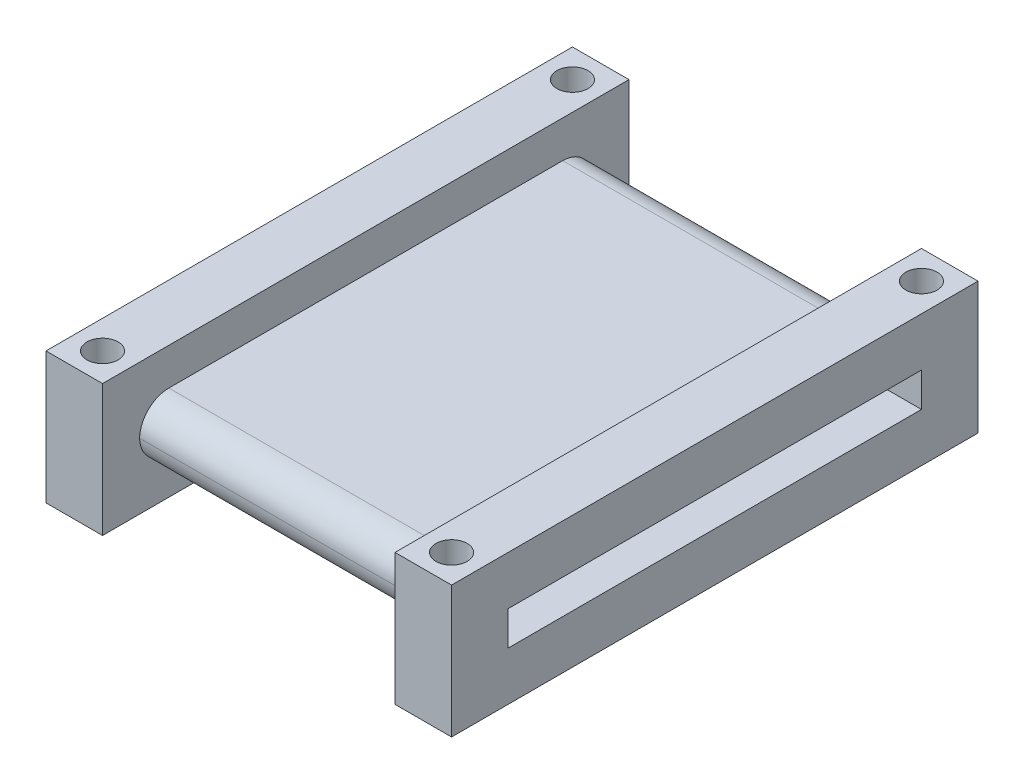
from build123d import *

# Parameters (mm, degrees)
SKETCH1_W           = 46.4
SKETCH1_H           = 5.9
SKETCH1_W_2         = 42.4
SKETCH1_H_2         = 3.5
BOSS_EXTRUDE1_DEPTH = 30
FILLET2_R           = 3
SKETCH2_W           = 54
SKETCH2_H           = 13.5
SKETCH2_W_2         = 42.4
SKETCH2_H_2         = 3.5
BOSS_EXTRUDE2_DEPTH = 5.8
SKETCH3_W           = 54
SKETCH3_H           = 13.5
SKETCH3_W_2         = 42.4
SKETCH3_H_2         = 3.5
BOSS_EXTRUDE3_DEPTH = 5.8
SKETCH4_R           = 1.6
CUT_EXTRUDE1_DEPTH  = 64.118380841


with BuildPart() as part:
    # Sketch1 → Boss-Extrude1 (new body)
    with BuildSketch(Plane(origin=(0, 0, 0), x_dir=(0, 0, -1), z_dir=(1, 0, 0))):
        with Locations((23.2, 2.95)):
            Rectangle(SKETCH1_W, SKETCH1_H)
        with Locations((23.2, 2.95)):
            Rectangle(SKETCH1_W_2, SKETCH1_H_2, mode=Mode.SUBTRACT)
    extrude(amount=BOSS_EXTRUDE1_DEPTH)

    # Fillet2
    # the kernel refuses this fillet: 3 mm, written as the material it takes off along each edge
    with BuildSketch(Plane(origin=(-7.5, 0, -46.4), x_dir=(0, 0, 1), z_dir=(1, 0, 0)), Plane(origin=(-7.5, 5.9, 0), x_dir=(0, 0, -1), z_dir=(1, 0, 0)), Plane(origin=(-7.5, 5.9, -46.4), x_dir=(0, -1, 0), z_dir=(1, 0, 0))) as fillet2_piece_1:
        with BuildLine():
            CenterArc((FILLET2_R, -FILLET2_R), FILLET2_R, 90, 90)
            Line((0, -FILLET2_R), (0, 0))
            Line((0, 0), (FILLET2_R, 0))
        make_face()
    extrude(amount=45, mode=Mode.SUBTRACT)
    with BuildSketch(Plane(origin=(-7.5, 0, 0), x_dir=(0, 0, -1), z_dir=(1, 0, 0))) as fillet2_piece_2:
        with BuildLine():
            CenterArc((FILLET2_R, FILLET2_R), FILLET2_R, 180, 90)
            Line((0, FILLET2_R), (0, 0))
            Line((0, 0), (FILLET2_R, 0))
        make_face()
    extrude(amount=45, mode=Mode.SUBTRACT)

    # Sketch2 → Boss-Extrude2 (add)
    with BuildSketch(Plane(origin=(30, 0, 0), x_dir=(0, 0, -1), z_dir=(1, 0, 0))):
        with Locations((23.2, 2.95)):
            Rectangle(SKETCH2_W, SKETCH2_H)
        with Locations((23.2, 2.95)):
            Rectangle(SKETCH2_W_2, SKETCH2_H_2, mode=Mode.SUBTRACT)
    extrude(amount=BOSS_EXTRUDE2_DEPTH)

    # Sketch3 → Boss-Extrude3 (add)
    with BuildSketch(Plane.ZY):
        with Locations((-23.2, 2.95)):
            Rectangle(SKETCH3_W, SKETCH3_H)
        with Locations((-23.2, 2.95)):
            Rectangle(SKETCH3_W_2, SKETCH3_H_2, mode=Mode.SUBTRACT)
    extrude(amount=BOSS_EXTRUDE3_DEPTH)

    # Sketch4 → Cut-Extrude1 (cut, through all)
    with BuildSketch(Plane(origin=(0, 9.7, 0), x_dir=(1, 0, 0), z_dir=(0, 1, 0))):
        with Locations(Location((-2.9, 47.3, 0), (0, 0, 270))):
            Circle(SKETCH4_R)
        with Locations(Location((32.9, 47.3, 0), (0, 0, 270))):
            Circle(SKETCH4_R)
        with Locations(Location((-2.9, -0.9, 0), (0, 0, 270))):
            Circle(SKETCH4_R)
        with Locations(Location((32.9, -0.9, 0), (0, 0, 270))):
            Circle(SKETCH4_R)
    extrude(amount=-CUT_EXTRUDE1_DEPTH, mode=Mode.SUBTRACT)


solid = part.part
